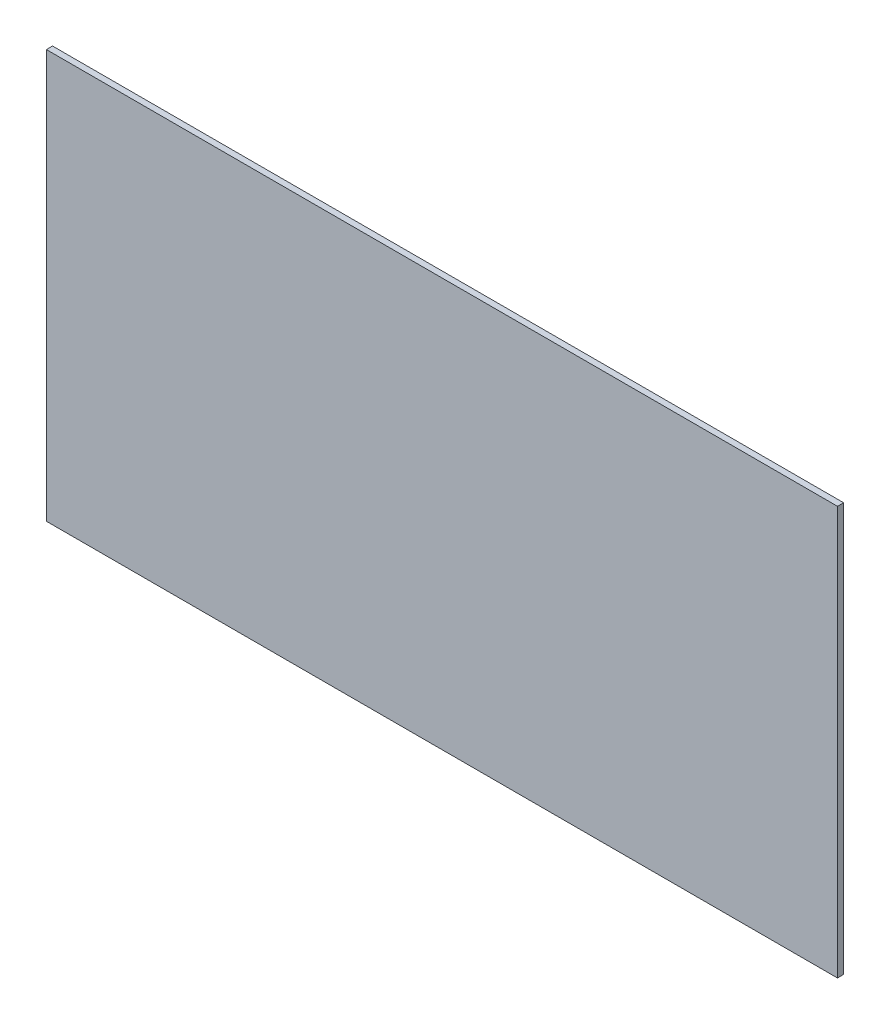
from build123d import *

# Parameters (mm, degrees)
SKETCH1_W           = 579
SKETCH1_H           = 299
BOSS_EXTRUDE1_DEPTH = 2.2479


with BuildPart() as part:
    # Sketch1 → Boss-Extrude1 (new, symmetric)
    with BuildSketch(Plane.XY):
        Rectangle(SKETCH1_W, SKETCH1_H)
    extrude(amount=BOSS_EXTRUDE1_DEPTH, both=True)


solid = part.part
